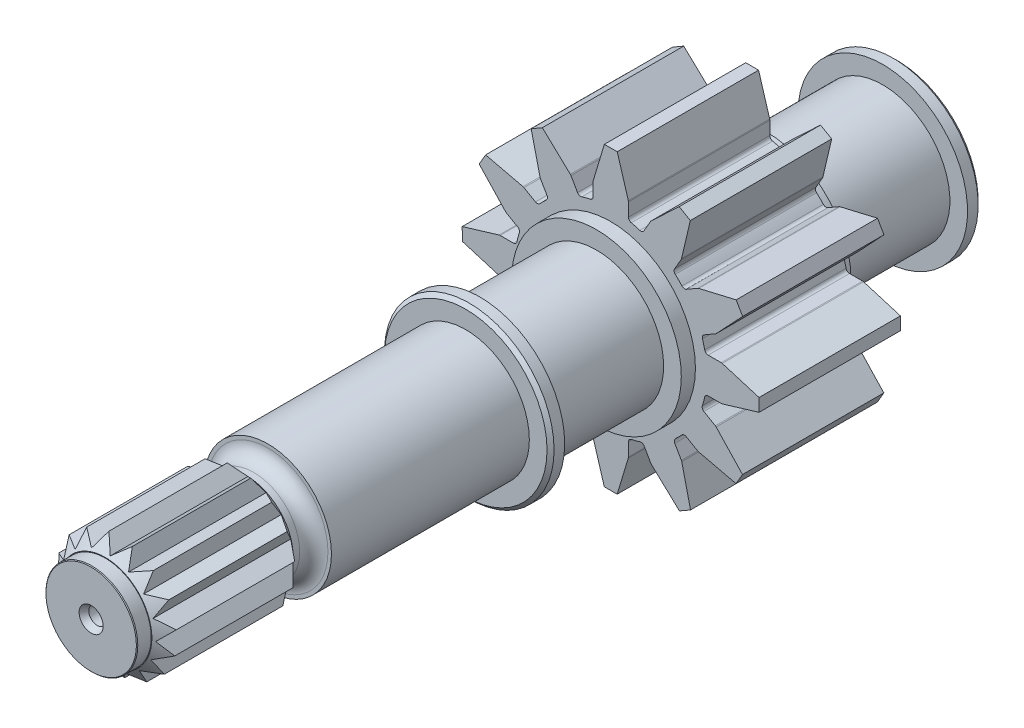
from build123d import *

# Parameters (mm, degrees)
EXTRUDE_1_DEPTH      = 20
SKETCH_3_R           = 12
EXTRUDE_2_DEPTH      = 2
EXTRUDE_START        = 2
SKETCH_4_R           = 12
EXTRUDE_3_DEPTH      = 2
SKETCH_5_R           = 9.5
EXTRUDE_4_DEPTH      = 16.5
SKETCH_6_R           = 12
EXTRUDE_5_DEPTH      = 2
CHAMFER_2_SIZE       = 0.5
EXTRUDE_START_2      = 16.5
SKETCH_7_R           = 9.5
EXTRUDE_6_DEPTH      = 16.5
SKETCH_8_R           = 12
EXTRUDE_7_DEPTH      = 2
CHAMFER_3_SIZE       = 0.5
SKETCH_10_R          = 9
EXTRUDE_9_DEPTH      = 28
SKETCH_11_R          = 6.5
EXTRUDE_10_DEPTH     = 3
FILLET_1_R           = 2
EXTRUDE_11_DEPTH     = 20
SKETCH_13_R          = 6.5
EXTRUDE_12_DEPTH     = 2
CHAMFER_5_SIZE       = 0.1
SKETCH_15_R          = 2.5
CUT_EXTRUDE_13_DEPTH = 74
CHAMFER_6_SIZE       = 0.5
CHAMFER_6_SIZE2      = 0.866025404
SKETCH_16_R          = 1
CUT_EXTRUDE_14_DEPTH = 9
SKETCH_17_R          = 1.2
CUT_EXTRUDE_15_DEPTH = 7
CHAMFER_7_SIZE       = 0.5
CHAMFER_7_SIZE2      = 0.866025404


with BuildPart() as part:
    # Эскиз2 → Вытянуть1 (new body)
    with BuildSketch(Plane.XY):
        with BuildLine():
            Line((53.764538287, -2.946020686), (53.764538287, -1.077143616))
            ThreePointArc((53.764538287, -1.077143616), (53.759197394, -1.004257629), (53.743288818, -0.932928746))
            Line((53.743288818, -0.932928746), (52.174732421, 4.274212553))
            Line((52.174732421, 4.274212553), (50.354570926, 4.274212553))
            Line((50.354570926, 4.274212553), (48.785793437, -0.932919949))
            ThreePointArc((48.785793437, -0.932919949), (48.769880615, -1.004257948), (48.764538287, -1.077153679))
            Line((48.764538287, -1.077153679), (48.764538287, -2.953138509))
            ThreePointArc((48.764538287, -2.953138509), (48.653798767, -3.266947811), (48.370633173, -3.441752748))
            ThreePointArc((48.370633173, -3.441752748), (47.755574297, -3.590379289), (47.148101498, -3.767478327))
            ThreePointArc((47.148101498, -3.767478327), (46.816157953, -3.756991645), (46.564008916, -3.540849677))
            Line((46.564008916, -3.540849677), (45.628704767, -1.920855369))
            ThreePointArc((45.628704767, -1.920855369), (45.587636424, -1.860404698), (45.538194752, -1.806586362))
            Line((45.538194752, -1.806586362), (41.576214415, 1.918652085))
            Line((41.576214415, 1.918652085), (39.999908322, 1.008571338))
            Line((39.999908322, 1.008571338), (41.244873414, -4.285326434))
            ThreePointArc((41.244873414, -4.285326434), (41.266761505, -4.355063364), (41.298582779, -4.420864083))
            Line((41.298582779, -4.420864083), (42.233043669, -6.039397823))
            ThreePointArc((42.233043669, -6.039397823), (42.29400173, -6.366811555), (42.135803463, -6.659879713))
            ThreePointArc((42.135803463, -6.659879713), (41.671118276, -7.10145189), (41.227792451, -7.564464333))
            ThreePointArc((41.227792451, -7.564464333), (40.935062472, -7.721409797), (40.608582641, -7.660306282))
            Line((40.608582641, -7.660306282), (38.980519219, -6.720343428))
            ThreePointArc((38.980519219, -6.720343428), (38.914727656, -6.688525782), (38.845000744, -6.666638572))
            Line((38.845000744, -6.666638572), (33.551205899, -5.42147761))
            Line((33.551205899, -5.42147761), (32.641125152, -6.997783703))
            Line((32.641125152, -6.997783703), (36.36624071, -10.959946087))
            ThreePointArc((36.36624071, -10.959946087), (36.42007011, -11.009400187), (36.480534902, -11.050477203))
            Line((36.480534902, -11.050477203), (38.099195221, -11.984952893))
            ThreePointArc((38.099195221, -11.984952893), (38.3156739, -12.237948594), (38.325284093, -12.570781115))
            ThreePointArc((38.325284093, -12.570781115), (38.135802793, -13.215524272), (37.978453065, -13.868852647))
            ThreePointArc((37.978453065, -13.868852647), (37.803845806, -14.152755097), (37.48960436, -14.263843393))
            Line((37.48960436, -14.263843393), (35.609921104, -14.263843393))
            ThreePointArc((35.609921104, -14.263843393), (35.536992217, -14.269190608), (35.465623196, -14.285117883))
            Line((35.465623196, -14.285117883), (30.241497591, -15.859778889))
            Line((30.241497591, -15.859778889), (30.258564934, -17.673810753))
            Line((30.258564934, -17.673810753), (35.465697436, -19.242588243))
            ThreePointArc((35.465697436, -19.242588243), (35.537035435, -19.258501065), (35.609931166, -19.263843393))
            Line((35.609931166, -19.263843393), (37.515142589, -19.263843393))
            ThreePointArc((37.515142589, -19.263843393), (37.828138332, -19.373928448), (38.003309462, -19.655708734))
            ThreePointArc((38.003309462, -19.655708734), (38.149518751, -20.25162588), (38.322513601, -20.840325449))
            ThreePointArc((38.322513601, -20.840325449), (38.312380747, -21.172625221), (38.09610656, -21.425115396))
            Line((38.09610656, -21.425115396), (36.477531273, -22.359600274))
            ThreePointArc((36.477531273, -22.359600274), (36.417080602, -22.400668616), (36.363262266, -22.450110289))
            Line((36.363262266, -22.450110289), (32.638023819, -26.412090625))
            Line((32.638023819, -26.412090625), (33.548104566, -27.988396718))
            Line((33.548104566, -27.988396718), (38.837821827, -26.744414757))
            ThreePointArc((38.837821827, -26.744414757), (38.911454943, -26.720963772), (38.980594997, -26.686446567))
            Line((38.980594997, -26.686446567), (40.557311134, -25.740478688))
            ThreePointArc((40.557311134, -25.740478688), (40.887974912, -25.674653662), (41.185251899, -25.833706677))
            ThreePointArc((41.185251899, -25.833706677), (41.655272975, -26.327509287), (42.149482788, -26.797102185))
            ThreePointArc((42.149482788, -26.797102185), (42.308189645, -27.09030597), (42.247291035, -27.418098106))
            Line((42.247291035, -27.418098106), (41.313149687, -29.036078382))
            ThreePointArc((41.313149687, -29.036078382), (41.281332042, -29.101869945), (41.259444832, -29.171596858))
            Line((41.259444832, -29.171596858), (40.014283869, -34.465391703))
            Line((40.014283869, -34.465391703), (41.590589962, -35.37547245))
            Line((41.590589962, -35.37547245), (45.552970023, -31.650152239))
            ThreePointArc((45.552970023, -31.650152239), (45.602242473, -31.596552031), (45.643208409, -31.536364418))
            Line((45.643208409, -31.536364418), (46.589687492, -29.901332509))
            ThreePointArc((46.589687492, -29.901332509), (46.841408349, -29.685740418), (47.172658361, -29.674934436))
            ThreePointArc((47.172658361, -29.674934436), (47.763729285, -29.846529298), (48.361967201, -29.991170333))
            ThreePointArc((48.361967201, -29.991170333), (48.644883646, -30.166041654), (48.75550534, -30.479704745))
            Line((48.75550534, -30.479704745), (48.75550534, -32.34734856))
            ThreePointArc((48.75550534, -32.34734856), (48.760846232, -32.420234547), (48.776754809, -32.49156343))
            Line((48.776754809, -32.49156343), (50.345311205, -37.698704729))
            Line((50.345311205, -37.698704729), (52.1654727, -37.698704729))
            Line((52.1654727, -37.698704729), (53.734250189, -32.491572227))
            ThreePointArc((53.734250189, -32.491572227), (53.750163012, -32.420234228), (53.75550534, -32.347338497))
            Line((53.75550534, -32.347338497), (53.75550534, -30.477514017))
            ThreePointArc((53.75550534, -30.477514017), (53.866087201, -30.163900379), (54.148919394, -29.989006661))
            ThreePointArc((54.148919394, -29.989006661), (54.776030579, -29.836482847), (55.395187259, -29.654337418))
            ThreePointArc((55.395187259, -29.654337418), (55.727840657, -29.664117847), (55.980669977, -29.880523195))
            Line((55.980669977, -29.880523195), (56.918293093, -31.50453407))
            ThreePointArc((56.918293093, -31.50453407), (56.959361435, -31.564984741), (57.008803108, -31.618803077))
            Line((57.008803108, -31.618803077), (60.970783444, -35.344041525))
            Line((60.970783444, -35.344041525), (62.547089537, -34.433960777))
            Line((62.547089537, -34.433960777), (61.302124446, -29.140063005))
            ThreePointArc((61.302124446, -29.140063005), (61.280236354, -29.070326075), (61.248415081, -29.004525356))
            Line((61.248415081, -29.004525356), (60.313352567, -27.384949575))
            ThreePointArc((60.313352567, -27.384949575), (60.252285616, -27.058233892), (60.409547147, -26.765418044))
            ThreePointArc((60.409547147, -26.765418044), (60.874734414, -26.320800568), (61.318355435, -25.854662946))
            ThreePointArc((61.318355435, -25.854662946), (61.611362594, -25.69669226), (61.938606865, -25.757676849))
            Line((61.938606865, -25.757676849), (63.556770089, -26.691923822))
            ThreePointArc((63.556770089, -26.691923822), (63.622561652, -26.723741467), (63.692288565, -26.745628677))
            Line((63.692288565, -26.745628677), (68.986083409, -27.990789639))
            Line((68.986083409, -27.990789639), (69.896164156, -26.414483546))
            Line((69.896164156, -26.414483546), (66.171043874, -22.452316137))
            ThreePointArc((66.171043874, -22.452316137), (66.117219766, -22.402866229), (66.056761375, -22.361791772))
            Line((66.056761375, -22.361791772), (64.43714748, -21.426707253))
            ThreePointArc((64.43714748, -21.426707253), (64.220913014, -21.174319639), (64.210673714, -20.84212691))
            ThreePointArc((64.210673714, -20.84212691), (64.390016693, -20.228801746), (64.540344527, -19.607727513))
            ThreePointArc((64.540344527, -19.607727513), (64.715163733, -19.324615398), (65.028941656, -19.213901173))
            Line((65.028941656, -19.213901173), (66.888769323, -19.213901173))
            ThreePointArc((66.888769323, -19.213901173), (66.961655311, -19.208560281), (67.032984194, -19.192651704))
            Line((67.032984194, -19.192651704), (72.240125492, -17.624095307))
            Line((72.240125492, -17.624095307), (72.240125492, -15.803933813))
            Line((72.240125492, -15.803933813), (67.033013036, -14.235162363))
            ThreePointArc((67.033013036, -14.235162363), (66.961654766, -14.219246553), (66.888738326, -14.213907214))
            Line((66.888738326, -14.213907214), (65.038418761, -14.214058869))
            ThreePointArc((65.038418761, -14.214058869), (64.724765213, -14.103477871), (64.549862276, -13.820607462))
            ThreePointArc((64.549862276, -13.820607462), (64.40200748, -13.210628208), (64.226184375, -12.608115166))
            ThreePointArc((64.226184375, -12.608115166), (64.236662079, -12.276162568), (64.452807408, -12.024004868))
            Line((64.452807408, -12.024004868), (66.072795877, -11.088704089))
            ThreePointArc((66.072795877, -11.088704089), (66.133246547, -11.047635747), (66.187064884, -10.998194074))
            Line((66.187064884, -10.998194074), (69.912303331, -7.036213738))
            Line((69.912303331, -7.036213738), (69.002222584, -5.459907645))
            Line((69.002222584, -5.459907645), (63.708324812, -6.704872737))
            ThreePointArc((63.708324812, -6.704872737), (63.638587881, -6.726760828), (63.572787163, -6.758582102))
            Line((63.572787163, -6.758582102), (61.954455243, -7.692926471))
            ThreePointArc((61.954455243, -7.692926471), (61.626900937, -7.75386248), (61.3337823, -7.595475342))
            ThreePointArc((61.3337823, -7.595475342), (60.870851004, -7.108824873), (60.384451797, -6.645629585))
            ThreePointArc((60.384451797, -6.645629585), (60.226244716, -6.352559068), (60.287201748, -6.025138774))
            Line((60.287201748, -6.025138774), (61.21857227, -4.41195771))
            ThreePointArc((61.21857227, -4.41195771), (61.250389916, -4.346166146), (61.272277126, -4.276439234))
            Line((61.272277126, -4.276439234), (62.517438088, 1.017355611))
            Line((62.517438088, 1.017355611), (60.941131995, 1.927436358))
            Line((60.941131995, 1.927436358), (56.978964585, -1.797683924))
            ThreePointArc((56.978964585, -1.797683924), (56.929514677, -1.851508033), (56.88844022, -1.911966424))
            Line((56.88844022, -1.911966424), (55.953232083, -3.531794433))
            ThreePointArc((55.953232083, -3.531794433), (55.70097994, -3.747976393), (55.368928673, -3.758356204))
            ThreePointArc((55.368928673, -3.758356204), (54.767086452, -3.582459006), (54.157776241, -3.434489586))
            ThreePointArc((54.157776241, -3.434489586), (53.875063626, -3.259564126), (53.764538287, -2.946020686))
        make_face()
    extrude(amount=EXTRUDE_1_DEPTH)

    # Эскиз3 → Вытянуть2 (add)
    with BuildSketch(Plane(origin=(0, 0, 0), x_dir=(-1, 0, 0), z_dir=(0, 0, -1))):
        with Locations((-51.240125492, -16.733104028)):
            Circle(SKETCH_3_R)
    extrude(amount=EXTRUDE_2_DEPTH)

    # Эскиз4 → Вытянуть3 (add)
    with BuildSketch(Plane.XY.offset(20).offset(EXTRUDE_START)):
        with Locations((51.240125492, -16.733104028)):
            Circle(SKETCH_4_R)
    extrude(amount=-EXTRUDE_3_DEPTH)

    # Эскиз5 → Вытянуть4 (add)
    with BuildSketch(Plane(origin=(0, 0, -2), x_dir=(-1, 0, 0), z_dir=(0, 0, -1))):
        with Locations((-51.240125492, -16.733104028)):
            Circle(SKETCH_5_R)
    extrude(amount=EXTRUDE_4_DEPTH)

    # Эскиз6 → Вытянуть5 (add)
    with BuildSketch(Plane(origin=(0, 0, -18.5), x_dir=(-1, 0, 0), z_dir=(0, 0, -1))):
        with Locations((-51.240125492, -16.733104028)):
            Circle(SKETCH_6_R)
    extrude(amount=EXTRUDE_5_DEPTH)

    # Фаска2
    chamfer_2_edges = [part.edges().sort_by_distance(p)[0] for p in [
        (63.240125492, -16.733104028, -20.5),
    ]]
    chamfer(chamfer_2_edges, length=CHAMFER_2_SIZE)

    # Эскиз7 → Вытянуть6 (add)
    with BuildSketch(Plane.XY.offset(22).offset(EXTRUDE_START_2)):
        with Locations((51.240125492, -16.733104028)):
            Circle(SKETCH_7_R)
    extrude(amount=-EXTRUDE_6_DEPTH)

    # Эскиз8 → Вытянуть7 (add)
    with BuildSketch(Plane.XY.offset(38.5).offset(EXTRUDE_START)):
        with Locations((51.240125492, -16.733104028)):
            Circle(SKETCH_8_R)
    extrude(amount=-EXTRUDE_7_DEPTH)

    # Фаска3
    chamfer_3_edges = [part.edges().sort_by_distance(p)[0] for p in [
        (39.240125492, -16.733104028, 40.5),
    ]]
    chamfer(chamfer_3_edges, length=CHAMFER_3_SIZE)

    # Эскиз10 → Вытянуть9 (add)
    with BuildSketch(Plane.XY.offset(40.5)):
        with Locations((51.240125492, -16.733104028)):
            Circle(SKETCH_10_R)
    extrude(amount=EXTRUDE_9_DEPTH)

    # Эскиз11 → Вытянуть10 (add)
    with BuildSketch(Plane.XY.offset(68.5)):
        with Locations((51.240125492, -16.733104028)):
            Circle(SKETCH_11_R)
    extrude(amount=EXTRUDE_10_DEPTH)

    # Скругление1
    fillet_1_edges = [part.edges().sort_by_distance(p)[0] for p in [
        (44.740125492, -16.733104028, 68.5),
    ]]
    fillet(fillet_1_edges, radius=FILLET_1_R)

    # Эскиз12 → Вытянуть11 (add)
    with BuildSketch(Plane.XY.offset(71.5)):
        Polygon((52.350047055, -25.160326235), (53.45804216, -23.230479976), (55.490517626, -24.094093548), (55.775651435, -21.887136718), (57.983904525, -21.907216934), (57.402768001, -19.759138705), (59.450612199, -18.932628533), (58.091678108, -17.170454343), (59.667347699, -15.623182466), (57.73750144, -14.515187361), (58.601115012, -12.482711894), (56.394158182, -12.197578085), (56.414238398, -9.989324996), (54.266160169, -10.57046152), (53.439649998, -8.522617322), (51.677475807, -9.881551412), (50.13020393, -8.305881821), (49.022208825, -10.235728081), (46.989733359, -9.372114508), (46.70459955, -11.579071338), (44.49634646, -11.558991122), (45.077482984, -13.707069351), (43.029638786, -14.533579523), (44.388572877, -16.295753713), (42.812903286, -17.843025591), (44.742749545, -18.951020696), (43.879135973, -20.983496162), (46.086092803, -21.268629971), (46.066012587, -23.476883061), (48.214090816, -22.895746536), (49.040600987, -24.943590734), (50.802775178, -23.584656644), align=None)
    extrude(amount=EXTRUDE_11_DEPTH)

    # Эскиз13 → Вытянуть12 (add)
    with BuildSketch(Plane.XY.offset(91.5)):
        with Locations((51.240125492, -16.733104028)):
            Circle(SKETCH_13_R)
    extrude(amount=EXTRUDE_12_DEPTH)

    # Вырез-По траектории1: sweep along a curve in space
    with BuildLine() as sweep_1_path:
        ThreePointArc((57.740125492, -16.733104028, 71.5), (55.83631957, -12.13690995, 71.5), (51.240125492, -10.233104028, 71.5))
        ThreePointArc((51.240125492, -10.233104028, 71.5), (46.643931415, -12.13690995, 71.5), (44.740125492, -16.733104028, 71.5))
        ThreePointArc((44.740125492, -16.733104028, 71.5), (46.643931415, -21.329298106, 71.5), (51.240125492, -23.233104028, 71.5))
        ThreePointArc((51.240125492, -23.233104028, 71.5), (55.83631957, -21.329298106, 71.5), (57.740125492, -16.733104028, 71.5))
    # Эскиз14 → Вырез-По траектории1 (sweep, cut)
    with BuildSketch(Plane(origin=(19.954700446, 15.388446186, 0), x_dir=(0, 0, 1), z_dir=(-0.7918816576628084, -0.6106745780341628, 0))):
        Polygon((71.451586323, -40.520434253), (73.210876948, -37.651126648), (70.798909374, -37.651126648), align=None)
    sweep_1 = sweep(path=sweep_1_path.line, mode=Mode.SUBTRACT)

    # Зеркальное отражение1: Вырез-По траектории1 across plane
    add(sweep_1.mirror(Plane.XY.offset(81.5)), mode=Mode.SUBTRACT)

    # Зеркальное отражение2 copy 1: sweep along a curve in space
    with BuildLine() as mirror_2_copy_1_path:
        ThreePointArc((57.740125492, -16.733104028, 71.5), (55.83631957, -12.13690995, 71.5), (51.240125492, -10.233104028, 71.5))
        ThreePointArc((51.240125492, -10.233104028, 71.5), (46.643931415, -12.13690995, 71.5), (44.740125492, -16.733104028, 71.5))
        ThreePointArc((44.740125492, -16.733104028, 71.5), (46.643931415, -21.329298106, 71.5), (51.240125492, -23.233104028, 71.5))
        ThreePointArc((51.240125492, -23.233104028, 71.5), (55.83631957, -21.329298106, 71.5), (57.740125492, -16.733104028, 71.5))
    # Зеркальное отражение2 copy 1 sketch → Зеркальное отражение2 copy 1 (sweep, cut)
    with BuildSketch(Plane(origin=(19.954700446, 15.388446186, 0), x_dir=(0, 0, 1), z_dir=(-0.7918816576628084, -0.6106745780341628, 0))):
        Polygon((71.451586323, -40.520434253), (73.210876948, -37.651126648), (70.798909374, -37.651126648), align=None)
    sweep(path=mirror_2_copy_1_path.line, mode=Mode.SUBTRACT)

    # Зеркальное отражение2 copy 2: sweep along a curve in space
    with BuildLine() as mirror_2_copy_2_path:
        ThreePointArc((57.740125492, -16.733104028, 91.5), (55.83631957, -12.13690995, 91.5), (51.240125492, -10.233104028, 91.5))
        ThreePointArc((51.240125492, -10.233104028, 91.5), (46.643931415, -12.13690995, 91.5), (44.740125492, -16.733104028, 91.5))
        ThreePointArc((44.740125492, -16.733104028, 91.5), (46.643931415, -21.329298106, 91.5), (51.240125492, -23.233104028, 91.5))
        ThreePointArc((51.240125492, -23.233104028, 91.5), (55.83631957, -21.329298106, 91.5), (57.740125492, -16.733104028, 91.5))
    # Зеркальное отражение2 copy 2 sketch → Зеркальное отражение2 copy 2 (sweep, cut)
    with BuildSketch(Plane(origin=(19.954700446, 15.388446186, 163), x_dir=(0, 0, -1), z_dir=(-0.7918816576628084, -0.6106745780341628, 0))):
        Polygon((71.451586323, 40.520434253), (73.210876948, 37.651126648), (70.798909374, 37.651126648), align=None)
    sweep(path=mirror_2_copy_2_path.line, mode=Mode.SUBTRACT)

    # Фаска5
    chamfer_5_edges = [part.edges().sort_by_distance(p)[0] for p in [
        (44.740125492, -16.733104028, 93.5),
    ]]
    chamfer(chamfer_5_edges, length=CHAMFER_5_SIZE)

    # Эскиз15 → Вытянуть13 (cut)
    with BuildSketch(Plane(origin=(0, 0, -20.5), x_dir=(-1, 0, 0), z_dir=(0, 0, -1))):
        with Locations((-51.240125492, -16.733104028)):
            Circle(SKETCH_15_R)
    extrude(amount=-CUT_EXTRUDE_13_DEPTH, mode=Mode.SUBTRACT)

    # Фаска6
    chamfer_6_edges = [part.edges().sort_by_distance(p)[0] for p in [
        (53.740125492, -16.733104028, -20.5),
    ]]
    chamfer_6_side = [part.faces().sort_by_distance(p)[0] for p in [
        (62.414856373, -16.733104028, -20.5),
    ]]
    chamfer(chamfer_6_edges, length=CHAMFER_6_SIZE, length2=CHAMFER_6_SIZE2, reference=chamfer_6_side[0])

    # Эскиз16 → Вытянуть14 (cut)
    with BuildSketch(Plane(origin=(40, 0, 0), x_dir=(0, 0, -1), z_dir=(1, 0, 0))):
        with Locations((-44.658264315, -16.30213081)):
            Circle(SKETCH_16_R)
    extrude(amount=CUT_EXTRUDE_14_DEPTH, mode=Mode.SUBTRACT)

    # Эскиз17 → Вытянуть15 (cut)
    with BuildSketch(Plane.XY.offset(93.5)):
        with Locations((51.240125492, -16.733104028)):
            Circle(SKETCH_17_R)
    extrude(amount=-CUT_EXTRUDE_15_DEPTH, mode=Mode.SUBTRACT)

    # Фаска7
    chamfer_7_edges = [part.edges().sort_by_distance(p)[0] for p in [
        (50.040125492, -16.733104028, 93.5),
    ]]
    chamfer_7_side = [part.faces().sort_by_distance(p)[0] for p in [
        (45.021144828, -16.733104028, 93.5),
    ]]
    chamfer(chamfer_7_edges, length=CHAMFER_7_SIZE, length2=CHAMFER_7_SIZE2, reference=chamfer_7_side[0])


solid = part.part
